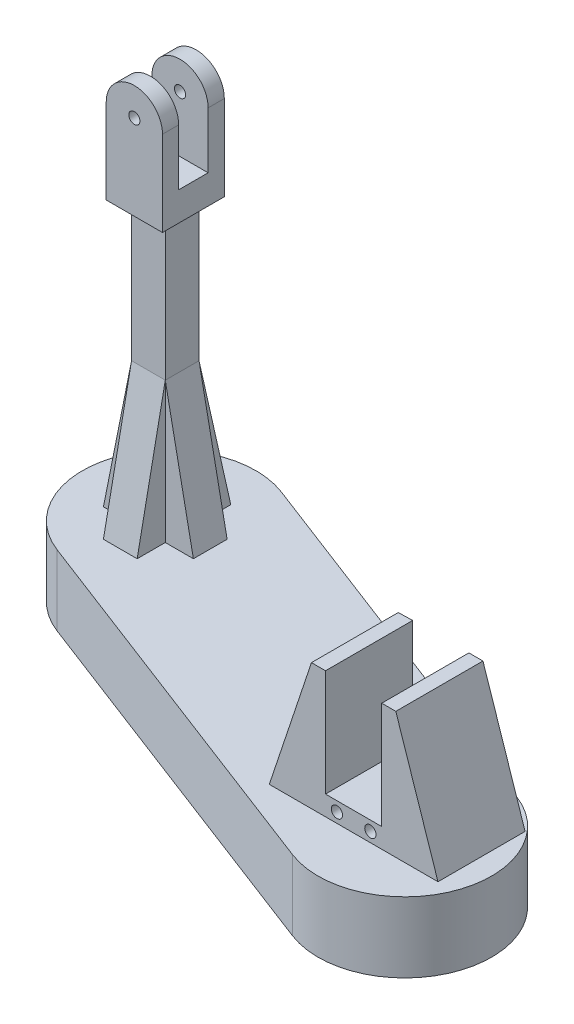
from build123d import *

# Parameters (mm, degrees)
EXTRUDE_1_DEPTH      = 12
CUT_EXTRUDE_1_DEPTH  = 39.218600963
CUT_EXTRUDE_6_DEPTH  = 39.218600963
SKETCH_12_R          = 1.985
EXTRUDE_11_DEPTH     = 5
EXTRUDE_START        = 5
SKETCH_13_R          = 1.985
EXTRUDE_12_DEPTH     = 5
SKETCH_14_W          = 10.08
SKETCH_14_H          = 30
CUT_EXTRUDE_7_DEPTH  = 41.070705753
SKETCH_15_W          = 12
SKETCH_15_H          = 12
EXTRUDE_13_DEPTH     = 100
SKETCH_16_W          = 237
SKETCH_16_H          = 150
EXTRUDE_14_DEPTH     = 25
EXTRUDE_19_DEPTH     = 7
SKETCH_31_W          = 5
SKETCH_31_H          = 31
EXTRUDE_20_DEPTH     = 45
EXTRUDE_21_DEPTH     = 31
SKETCH_35_R          = 2
CUT_EXTRUDE_16_DEPTH = 252.729549014
SKETCH_38_W          = 10.48
SKETCH_38_H          = 30
CUT_EXTRUDE_18_DEPTH = 261.619964405
FILLET_2_R           = 10
EXTRUDE_22_DEPTH     = 12
EXTRUDE_23_DEPTH     = 12
SKETCH_43_W          = 261.871256573
SKETCH_43_H          = 176.72808866
CUT_EXTRUDE_19_DEPTH = 245.682392746


with BuildPart() as part:
    # 草圖1 → 填料-伸長1 (new body)
    with BuildSketch(Plane.XY):
        with BuildLine():
            ThreePointArc((10, 0), (0, 10), (-10, 0))
            Line((-10, 0), (-10, -30.276417548))
            Line((-10, -30.276417548), (10, -30.276417548))
            Line((10, -30.276417548), (10, 0))
        make_face()
        with BuildLine():
            ThreePointArc((0, -1.985), (-1.403606961, 1.403606961), (1.985, 0))
            ThreePointArc((1.985, 0), (1.403606961, -1.403606961), (0, -1.985))
        make_face(mode=Mode.SUBTRACT)
    extrude(amount=EXTRUDE_1_DEPTH)

    # 草圖2 → 除料-伸長1 (cut, through all)
    with BuildSketch(Plane(origin=(10, 0, 0), x_dir=(0, 0, -1), z_dir=(1, 0, 0))):
        Polygon((-9, 15.780779257), (-9, 0), (-8.60053373, -20), (-3, -20), (-3, 15.780779257), align=None)
    extrude(amount=-CUT_EXTRUDE_1_DEPTH, mode=Mode.SUBTRACT)

    # 草圖11 → 除料-伸長6 (cut, through all)
    with BuildSketch(Plane(origin=(10, 0, 0), x_dir=(0, 0, -1), z_dir=(1, 0, 0))):
        Polygon((-9, 0), (-9, -20), (-8.60053373, -20), align=None)
    extrude(amount=-CUT_EXTRUDE_6_DEPTH, mode=Mode.SUBTRACT)

    # 草圖12 → 填料-伸長11 (add)
    with BuildSketch(Plane.XY.offset(12)):
        with BuildLine():
            Line((10, -30.276417548), (10, 0))
            ThreePointArc((10, 0), (0, 10), (-10, 0))
            Line((-10, 0), (-10, -30.276417548))
            Line((-10, -30.276417548), (10, -30.276417548))
        make_face()
        Circle(SKETCH_12_R, mode=Mode.SUBTRACT)
    extrude(amount=EXTRUDE_11_DEPTH)

    # 草圖13 → 填料-伸長12 (add)
    with BuildSketch(Plane(origin=(0, 0, 0), x_dir=(-1, 0, 0), z_dir=(0, 0, -1)).offset(EXTRUDE_START)):
        with BuildLine():
            Line((10, -30.276417548), (10, 0))
            ThreePointArc((10, 0), (0, 10), (-10, 0))
            Line((-10, 0), (-10, -30.276417548))
            Line((-10, -30.276417548), (10, -30.276417548))
        make_face()
        Circle(SKETCH_13_R, mode=Mode.SUBTRACT)
    extrude(amount=-EXTRUDE_12_DEPTH)

    # 草圖14 → 除料-伸長7 (cut, through all)
    with BuildSketch(Plane.ZY.offset(10)):
        with Locations((6, -5)):
            Rectangle(SKETCH_14_W, SKETCH_14_H)
    extrude(amount=-CUT_EXTRUDE_7_DEPTH, mode=Mode.SUBTRACT)

    # 草圖15 → 填料-伸長13 (add)
    with BuildSketch(Plane.XZ.offset(30.276417548)):
        with Locations((0, 6)):
            Rectangle(SKETCH_15_W, SKETCH_15_H)
    extrude(amount=EXTRUDE_13_DEPTH)

    # 草圖16 → 填料-伸長14 (add)
    with BuildSketch(Plane.XZ.offset(130.276417548)):
        with Locations((57.5, 21)):
            Rectangle(SKETCH_16_W, SKETCH_16_H)
    extrude(amount=EXTRUDE_14_DEPTH)

    # 草圖30 → 填料-伸長19 (add)
    with BuildSketch(Plane(origin=(0, -130.276417548, 0), x_dir=(1, 0, 0), z_dir=(0, 1, 0))):
        Polygon((139, -37), (129, -37), (119, -37), (119, -68), (139, -68), align=None)
    extrude(amount=EXTRUDE_19_DEPTH)

    # 草圖31 → 填料-伸長20 (add)
    with BuildSketch(Plane(origin=(0, -130.276417548, 0), x_dir=(1, 0, 0), z_dir=(0, 1, 0))):
        Polygon((119, -68), (114, -68), (114, -37.129725066), (119, -37), align=None)
        with Locations((141.5, -52.5)):
            Rectangle(SKETCH_31_W, SKETCH_31_H)
    extrude(amount=EXTRUDE_20_DEPTH)

    # 草圖33 → 填料-伸長21 (add)
    with BuildSketch(Plane.XY.offset(68)):
        Polygon((114, -130.276417548), (114, -85.276417548), (99, -130.276417548), align=None)
        Polygon((159, -130.276417548), (144, -85.276417548), (144, -130.276417548), align=None)
    extrude(amount=-EXTRUDE_21_DEPTH)

    # 草圖35 → 除料-伸長16 (cut, through all)
    with BuildSketch(Plane(origin=(0, 0, 37), x_dir=(-1, 0, 0), z_dir=(0, 0, -1))):
        with Locations((-134.95, -126.776417548)):
            Circle(SKETCH_35_R)
        with Locations((-123.05, -126.776417548)):
            Circle(SKETCH_35_R)
    extrude(amount=-CUT_EXTRUDE_16_DEPTH, mode=Mode.SUBTRACT)

    # 草圖38 → 除料-伸長18 (cut, through all)
    with BuildSketch(Plane.ZY.offset(10)):
        with Locations((6, -5)):
            Rectangle(SKETCH_38_W, SKETCH_38_H)
    extrude(amount=-CUT_EXTRUDE_18_DEPTH, mode=Mode.SUBTRACT)

    # 圓角2
    fillet_2_edges = [part.edges().sort_by_distance(p)[0] for p in [
        (176, -142.776417548, -54),
        (176, -142.776417548, 96),
        (-61, -142.776417548, -54),
        (-61, -142.776417548, 96),
    ]]
    fillet(fillet_2_edges, radius=FILLET_2_R)

    # 草圖39 → 填料-伸長22 (add)
    with BuildSketch(Plane(origin=(0, 0, 0), x_dir=(-1, 0, 0), z_dir=(0, 0, -1))):
        Polygon((-6, -80.276417548), (-16, -130.276417548), (-6, -130.276417548), align=None)
        Polygon((6, -80.276417548), (16, -130.276417548), (6, -130.276417548), align=None)
    extrude(amount=-EXTRUDE_22_DEPTH)

    # 草圖40 → 填料-伸長23 (add)
    with BuildSketch(Plane(origin=(6, 0, 0), x_dir=(0, 0, -1), z_dir=(1, 0, 0))):
        Polygon((-12, -80.276417548), (-22, -130.276417548), (-12, -130.276417548), align=None)
        Polygon((0, -80.276417548), (11.303196885, -130.276417548), (0, -130.276417548), align=None)
    extrude(amount=-EXTRUDE_23_DEPTH)

    # 草圖43 → 除料-伸長19 (cut, through all)
    with BuildSketch(Plane(origin=(0, -130.276417548, 0), x_dir=(1, 0, 0), z_dir=(0, 1, 0))):
        with Locations((55.959580844, -20.71992379)):
            Rectangle(SKETCH_43_W, SKETCH_43_H)
        with BuildLine():
            Line((11.052986493, 24.223320217), (146.97432536, -27.870854887))
            ThreePointArc((146.97432536, -27.870854887), (164.760200785, -67.762703298), (124.868352374, -85.548578724))
            Line((124.868352374, -85.548578724), (-11.052986493, -33.454403619))
            ThreePointArc((-11.052986493, -33.454403619), (-28.838861918, 6.437444792), (11.052986493, 24.223320217))
        make_face(mode=Mode.SUBTRACT)
    extrude(amount=-CUT_EXTRUDE_19_DEPTH, mode=Mode.SUBTRACT)


solid = part.part
